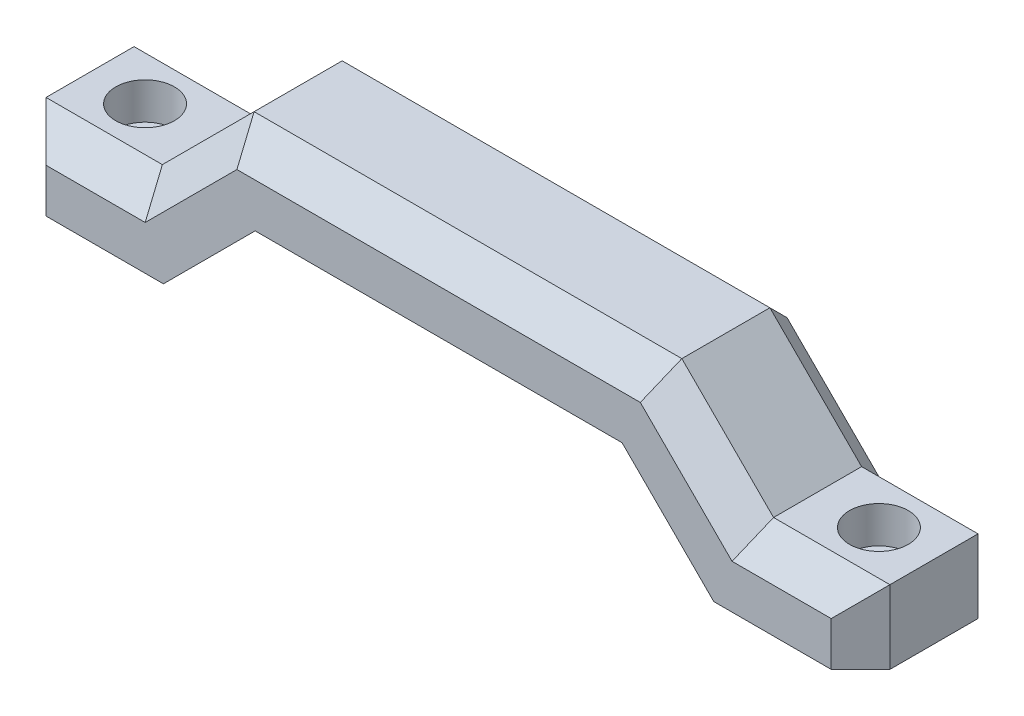
from build123d import *

# Parameters (mm, degrees)
BOSS_EXTRUDE1_DEPTH = 20
CHAMFER1_SIZE       = 4
SKETCH2_R           = 1.75
CUT_EXTRUDE1_DEPTH  = 63.149014473
SKETCH3_R           = 4
CUT_EXTRUDE2_DEPTH  = 5


with BuildPart() as part:
    # Sketch1 → Boss-Extrude1 (new body)
    with BuildSketch(Plane.XY):
        Polygon((-25, 0), (25, 0), (37.5, -12.5), (57.5, -12.5), (57.5, -2.5), (41.642135624, -2.5), (29.142135624, 10), (-29.142135624, 10), (-41.642135624, -2.5), (-57.5, -2.5), (-57.5, -12.5), (-37.5, -12.5), align=None)
    extrude(amount=BOSS_EXTRUDE1_DEPTH)

    # Chamfer1
    chamfer1_edges = [part.edges().sort_by_distance(p)[0] for p in [
        (-49.571067812, -2.5, 0),
        (-35.392135624, 3.75, 0),
        (0, 10, 0),
        (35.392135624, 3.75, 0),
        (49.571067812, -2.5, 0),
        (49.571067812, -2.5, 20),
        (35.392135624, 3.75, 20),
        (-49.571067812, -2.5, 20),
        (-35.392135624, 3.75, 20),
        (0, 10, 20),
        (-57.5, -7.5, 0),
        (57.5, -7.5, 0),
        (57.5, -7.5, 20),
        (-57.5, -7.5, 20),
    ]]
    chamfer(chamfer1_edges, length=CHAMFER1_SIZE)

    # Sketch2 → Cut-Extrude1 (cut, through all)
    with BuildSketch(Plane(origin=(0, -2.5, 0), x_dir=(1, 0, 0), z_dir=(0, 1, 0))):
        with Locations((-50, -10)):
            Circle(SKETCH2_R)
        with Locations((50, -10)):
            Circle(SKETCH2_R)
    extrude(amount=-CUT_EXTRUDE1_DEPTH, mode=Mode.SUBTRACT)

    # Sketch3 → Cut-Extrude2 (cut)
    with BuildSketch(Plane(origin=(0, -2.5, 0), x_dir=(1, 0, 0), z_dir=(0, 1, 0))):
        with Locations((-50, -10)):
            Circle(SKETCH3_R)
        with Locations((50, -10)):
            Circle(SKETCH3_R)
    extrude(amount=-CUT_EXTRUDE2_DEPTH, mode=Mode.SUBTRACT)


solid = part.part
